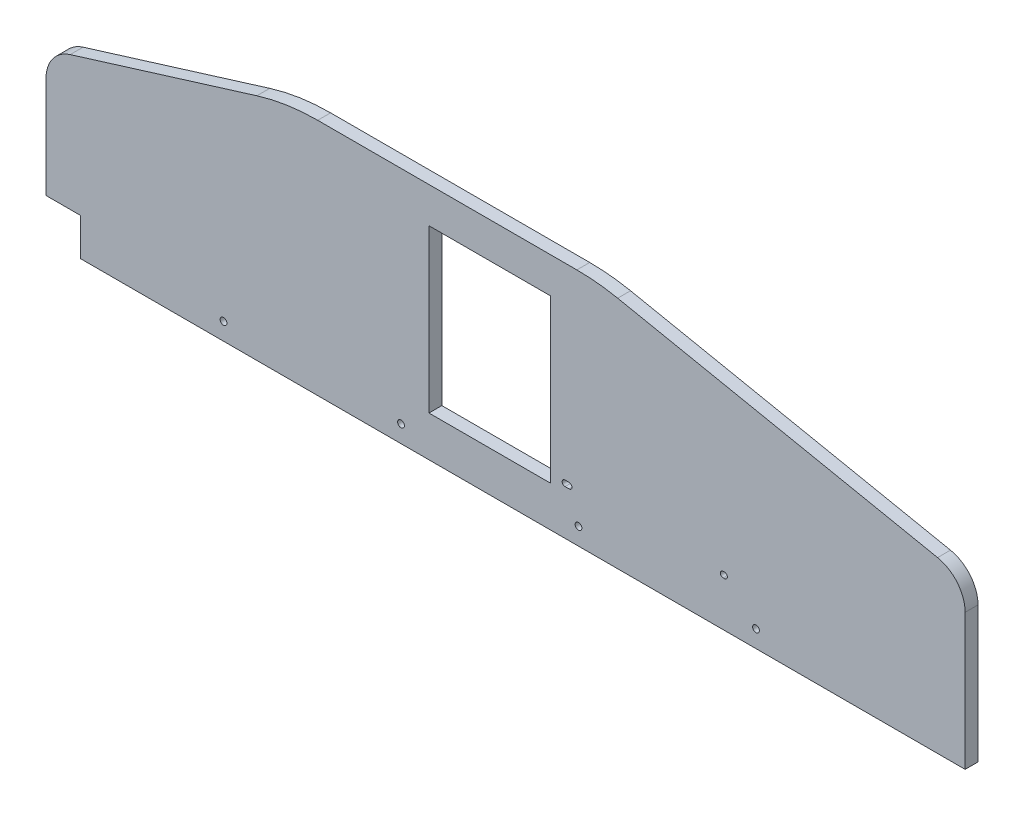
from build123d import *

# Parameters (mm, degrees)
BOSS_EXTRUDE1_DEPTH         = 4.7625
FILLET1_R                   = 25.4
SKETCH3_W                   = 25.4
SKETCH3_H                   = 27.686
CUT_EXTRUDE1_DEPTH          = 384.154910756
SKETCH5_W                   = 90
SKETCH5_H                   = 120
CUT_EXTRUDE2_DEPTH          = 384.154910756
TAP_DRILL_FOR_M6X1_0_TAP1_D = 5
CUT_EXTRUDE3_DEPTH          = 384.154910756
FILLET2_R                   = 152.4


with BuildPart() as part:
    # Sketch2 → Boss-Extrude1 (new, symmetric)
    with BuildSketch(Plane.XY):
        Polygon((-340, 26.400000032), (-340, 121.400000032), (-162, 176.400000032), (68, 176.400000032), (340, 121.400000032), (340, 26.400000032), (340, 0), (-340, 0), align=None)
    extrude(amount=BOSS_EXTRUDE1_DEPTH, both=True)

    # Fillet1
    fillet1_edges = [part.edges().sort_by_distance(p)[0] for p in [
        (340, 121.400000032, 0),
        (-340, 121.400000032, 0),
    ]]
    fillet(fillet1_edges, radius=FILLET1_R)

    # Sketch3 → Cut-Extrude1 (cut, through all)
    with BuildSketch(Plane.XY.offset(4.7625)):
        with Locations((-327.3, 13.843)):
            Rectangle(SKETCH3_W, SKETCH3_H)
    extrude(amount=-CUT_EXTRUDE1_DEPTH, mode=Mode.SUBTRACT)

    # Sketch5 → Cut-Extrude2 (cut, through all)
    with BuildSketch(Plane.XY.offset(4.7625)):
        with Locations((-11.668485666, 90)):
            Rectangle(SKETCH5_W, SKETCH5_H)
    extrude(amount=-CUT_EXTRUDE2_DEPTH, mode=Mode.SUBTRACT)

    # Tap Drill for M6x1.0 Tap1 (through all)
    with Locations(Plane.XY.offset(4.7625)):
        with Locations((-208.682, 12.7), (-77.364, 12.7), (53.954, 12.7), (185.272, 12.7)):
            Hole(TAP_DRILL_FOR_M6X1_0_TAP1_D / 2)

    # Sketch8 → Cut-Extrude3 (cut, through all)
    with BuildSketch(Plane.XY.offset(4.7625)):
        with BuildLine():
            Line((161, 37.4), (162, 37.4))
            ThreePointArc((162, 37.4), (164.1, 35.3), (162, 33.2))
            Line((162, 33.2), (161, 33.2))
            ThreePointArc((161, 33.2), (158.9, 35.3), (161, 37.4))
        make_face()
        with BuildLine():
            Line((47, 33.2), (44, 33.2))
            ThreePointArc((44, 33.2), (41.9, 35.3), (44, 37.4))
            Line((44, 37.4), (47, 37.4))
            ThreePointArc((47, 37.4), (49.1, 35.3), (47, 33.2))
        make_face()
    extrude(amount=-CUT_EXTRUDE3_DEPTH, mode=Mode.SUBTRACT)

    # Fillet2
    fillet2_edges = [part.edges().sort_by_distance(p)[0] for p in [
        (68, 176.400000032, 0),
        (-162, 176.400000032, 0),
    ]]
    fillet(fillet2_edges, radius=FILLET2_R)


solid = part.part
